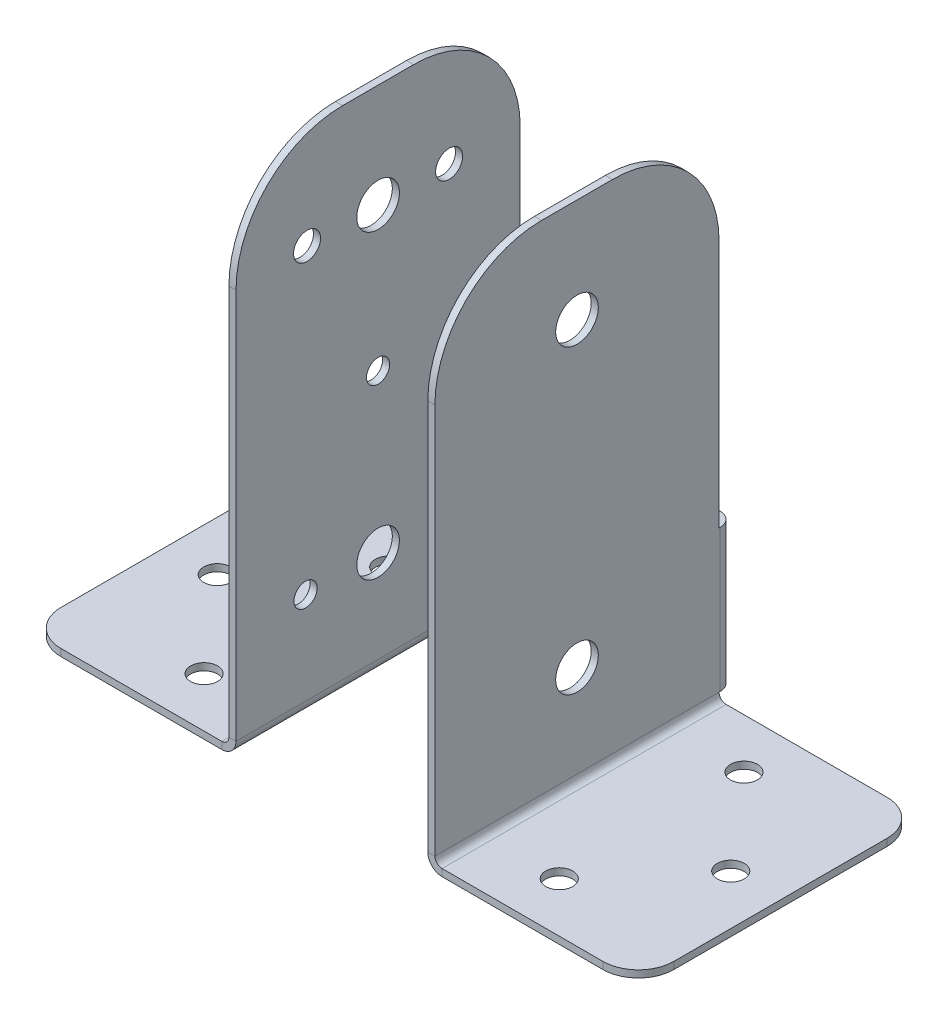
from build123d import *

# Parameters (mm, degrees)
BASE_FLANGE1_DEPTH         = 1
SKETCHED_START             = -40
SKETCHED_BEND3_OUTLINE_W   = 40
SKETCHED_BEND3_OUTLINE_H   = 1
SKETCHED_BEND3_DEPTH       = 28.18876
SKETCHED_START_2           = -11.2192
SKETCHED_BEND3_2_DEPTH     = 0.2192
SKETCHED_START_3           = -12
SKETCHED_BEND3_3_DEPTH     = 2
SKETCHED_START_4           = -56
SKETCHED_BEND3_4_DEPTH     = 112
SKETCHED_BEND7_DEPTH       = 72
SKETCHED_START_5           = -10
SKETCHED_BEND7_2_OUTLINE_W = 1
SKETCHED_BEND7_2_OUTLINE_H = 40
SKETCHED_BEND7_2_DEPTH     = 55
SKETCHED_BEND7_3_DEPTH     = 20
SKETCHED_BEND7_4_DEPTH     = 2
SKETCHED_START_6           = 45
SKETCHED_BEND7_5_OUTLINE_W = 1
SKETCHED_BEND7_5_OUTLINE_H = 40
SKETCHED_BEND7_5_DEPTH     = 15
SKETCHED_START_7           = 1.14380551
SKETCHED_BEND7_6_DEPTH     = 40
SKETCHED_START_8           = -38.14380551
SKETCHED_BEND7_7_DEPTH     = 76.28761102
SKETCH9_R                  = 3
CUT_EXTRUDE1_DEPTH         = 30
F_4_CLEARANCE_HOLE1_D      = 3.2639
F_4_CLEARANCE_HOLE1_DEPTH  = 3
F_4_CLEARANCE_HOLE1_TIP    = 0.980574487
F_6_CLEARANCE_HOLE1_D      = 3.7973
F_6_CLEARANCE_HOLE1_DEPTH  = 3
F_6_CLEARANCE_HOLE1_TIP    = 1.140824014
F_6_CLEARANCE_HOLE2_D      = 3.7973


with BuildPart() as part:
    # Base-Flange1: sheet metal written as solids
    # Sketch1 → Base-Flange1 (new body)
    with BuildSketch(Plane.XY):
        with BuildLine():
            Line((-15, -10), (-15, -35))
            ThreePointArc((-15, -35), (-16.464466094, -38.535533906), (-20, -40))
            Line((-20, -40), (-50, -40))
            ThreePointArc((-50, -40), (-53.535533906, -38.535533906), (-55, -35))
            Line((-55, -35), (-55, 45))
            ThreePointArc((-55, 45), (-50.606601718, 55.606601718), (-40, 60))
            Line((-40, 60), (-30, 60))
            ThreePointArc((-30, 60), (-19.393398282, 55.606601718), (-15, 45))
            Line((-15, 45), (-15, 10))
            Line((-15, 10), (15, 10))
            Line((15, 10), (15, 45))
            ThreePointArc((15, 45), (19.393398282, 55.606601718), (30, 60))
            Line((30, 60), (40, 60))
            ThreePointArc((40, 60), (50.606601718, 55.606601718), (55, 45))
            Line((55, 45), (55, -35))
            ThreePointArc((55, -35), (53.535533906, -38.535533906), (50, -40))
            Line((50, -40), (20, -40))
            ThreePointArc((20, -40), (16.464466094, -38.535533906), (15, -35))
            Line((15, -35), (15, -10))
            Line((15, -10), (-15, -10))
        make_face()
    extrude(amount=-BASE_FLANGE1_DEPTH)

    # Sketched Bend3: read off the stored shape, not the designer's step
    # Sketched Bend3 outline → Sketched Bend3 (cut)
    with BuildSketch(Plane(origin=(0, 0, 0), x_dir=(1, 0, 0), z_dir=(0, 1, 0)).offset(SKETCHED_START)):
        with Locations((-35, 0.5)):
            Rectangle(SKETCHED_BEND3_OUTLINE_W, SKETCHED_BEND3_OUTLINE_H)
        with Locations((35, 0.5)):
            Rectangle(SKETCHED_BEND3_OUTLINE_W, SKETCHED_BEND3_OUTLINE_H)
    extrude(amount=SKETCHED_BEND3_DEPTH, mode=Mode.SUBTRACT)

    # Sketched Bend3 2 outline → Sketched Bend3 2 (add)
    with BuildSketch(Plane(origin=(0, 0, 0), x_dir=(1, 0, 0), z_dir=(0, 1, 0)).offset(SKETCHED_START_2)):
        with BuildLine():
            Line((-15, 1), (-15, 24.64380551))
            ThreePointArc((-15, 24.64380551), (-16.464466094, 28.179339416), (-20, 29.64380551))
            Line((-20, 29.64380551), (-50, 29.64380551))
            ThreePointArc((-50, 29.64380551), (-53.535533906, 28.179339416), (-55, 24.64380551))
            Line((-55, 24.64380551), (-55, 1))
            Line((-55, 1), (-15, 1))
        make_face()
        with BuildLine():
            Line((15, 24.64380551), (15, 1))
            Line((15, 1), (55, 1))
            Line((55, 1), (55, 24.64380551))
            ThreePointArc((55, 24.64380551), (53.535533906, 28.179339416), (50, 29.64380551))
            Line((50, 29.64380551), (20, 29.64380551))
            ThreePointArc((20, 29.64380551), (16.464466094, 28.179339416), (15, 24.64380551))
        make_face()
    extrude(amount=SKETCHED_BEND3_2_DEPTH)

    # Sketched Bend3 3 outline → Sketched Bend3 3 (add)
    with BuildSketch(Plane(origin=(0, 0, 0), x_dir=(1, 0, 0), z_dir=(0, 1, 0)).offset(SKETCHED_START_3)):
        with BuildLine():
            Line((-15, 1), (-15, 24.64380551))
            ThreePointArc((-15, 24.64380551), (-16.464466094, 28.179339416), (-20, 29.64380551))
            Line((-20, 29.64380551), (-50, 29.64380551))
            ThreePointArc((-50, 29.64380551), (-53.535533906, 28.179339416), (-55, 24.64380551))
            Line((-55, 24.64380551), (-55, 1))
            Line((-55, 1), (-15, 1))
        make_face()
        with BuildLine():
            ThreePointArc((55, 24.64380551), (53.535533906, 28.179339416), (50, 29.64380551))
            Line((50, 29.64380551), (20, 29.64380551))
            ThreePointArc((20, 29.64380551), (16.464466094, 28.179339416), (15, 24.64380551))
            Line((15, 24.64380551), (15, 1))
            Line((15, 1), (55, 1))
            Line((55, 1), (55, 24.64380551))
        make_face()
    extrude(amount=SKETCHED_BEND3_3_DEPTH)

    # Sketched Bend3 4 outline → Sketched Bend3 4 (cut)
    with BuildSketch(Plane.YZ.offset(SKETCHED_START_4)):
        with BuildLine():
            Line((-11, -2), (-11, -29.64380551))
            Line((-11, -29.64380551), (-10, -29.64380551))
            Line((-10, -29.64380551), (-10, -1))
            ThreePointArc((-10, -1), (-10.707106781, -1.292893219), (-11, -2))
        make_face()
        with BuildLine():
            Line((-12, -1), (-12, -2))
            ThreePointArc((-12, -2), (-11.414213562, -0.585786438), (-10, 0))
            Line((-10, 0), (-11.81124, 0))
            Line((-11.81124, 0), (-11.81124, -1))
            Line((-11.81124, -1), (-12, -1))
        make_face()
    extrude(amount=SKETCHED_BEND3_4_DEPTH, mode=Mode.SUBTRACT)

    # Sketched Bend7: read off the stored shape, not the designer's step
    # Sketched Bend7 outline → Sketched Bend7 (cut)
    with BuildSketch(Plane(origin=(0, 0, 0), x_dir=(1, 0, 0), z_dir=(0, 1, 0)).offset(SKETCHED_START_3)):
        with BuildLine():
            ThreePointArc((-14.232050807, 0), (-13.5, 0.732050807), (-12.5, 1))
            Line((-12.5, 1), (-15, 1))
            Line((-15, 1), (-15, 24.64380551))
            ThreePointArc((-15, 24.64380551), (-16.464466094, 28.179339416), (-20, 29.64380551))
            Line((-20, 29.64380551), (-50, 29.64380551))
            ThreePointArc((-50, 29.64380551), (-53.535533906, 28.179339416), (-55, 24.64380551))
            Line((-55, 24.64380551), (-55, 0))
            Line((-55, 0), (-14.232050807, 0))
        make_face()
        with BuildLine():
            Line((15, 1), (12.5, 1))
            ThreePointArc((12.5, 1), (13.5, 0.732050807), (14.232050807, 0))
            Line((14.232050807, 0), (55, 0))
            Line((55, 0), (55, 24.64380551))
            ThreePointArc((55, 24.64380551), (53.535533906, 28.179339416), (50, 29.64380551))
            Line((50, 29.64380551), (20, 29.64380551))
            ThreePointArc((20, 29.64380551), (16.464466094, 28.179339416), (15, 24.64380551))
            Line((15, 24.64380551), (15, 1))
        make_face()
    extrude(amount=SKETCHED_BEND7_DEPTH, mode=Mode.SUBTRACT)



with BuildPart() as body_2:
    # Sketched Bend7 2 outline → Sketched Bend7 2 (new body)
    with BuildSketch(Plane(origin=(0, 0, 0), x_dir=(1, 0, 0), z_dir=(0, 1, 0)).offset(SKETCHED_START_5)):
        with Locations((-14, -21.14380551)):
            Rectangle(SKETCHED_BEND7_2_OUTLINE_W, SKETCHED_BEND7_2_OUTLINE_H)
        with Locations((14, -21.14380551)):
            Rectangle(SKETCHED_BEND7_2_OUTLINE_W, SKETCHED_BEND7_2_OUTLINE_H)
    extrude(amount=SKETCHED_BEND7_2_DEPTH)


with BuildPart() as part_1:
    add(part.part)

    add(body_2.part)  # Sketched Bend7 3 merges body 2
    # Sketched Bend7 3 outline → Sketched Bend7 3 (add)
    with BuildSketch(Plane(origin=(0, 0, 0), x_dir=(1, 0, 0), z_dir=(0, 1, 0)).offset(SKETCHED_START_5)):
        with BuildLine():
            Line((-12.5, 0), (-14.232050807, 0))
            ThreePointArc((-14.232050807, 0), (-14.431851652, -0.48236191), (-14.5, -1))
            Line((-14.5, -1), (-14.5, -1.14380551))
            Line((-14.5, -1.14380551), (-13.5, -1.14380551))
            Line((-13.5, -1.14380551), (-13.5, -1))
            ThreePointArc((-13.5, -1), (-13.207106781, -0.292893219), (-12.5, 0))
        make_face()
        with BuildLine():
            ThreePointArc((14.5, -1), (14.431851652, -0.48236191), (14.232050807, 0))
            Line((14.232050807, 0), (12.5, 0))
            ThreePointArc((12.5, 0), (13.207106781, -0.292893219), (13.5, -1))
            Line((13.5, -1), (13.5, -1.14380551))
            Line((13.5, -1.14380551), (14.5, -1.14380551))
            Line((14.5, -1.14380551), (14.5, -1))
        make_face()
    extrude(amount=SKETCHED_BEND7_3_DEPTH)

    # Sketched Bend7 4 outline → Sketched Bend7 4 (add)
    with BuildSketch(Plane(origin=(0, 0, 0), x_dir=(1, 0, 0), z_dir=(0, 1, 0)).offset(SKETCHED_START_3)):
        with BuildLine():
            ThreePointArc((-43.14380551, -36.14380551), (-41.679339416, -39.679339416), (-38.14380551, -41.14380551))
            Line((-38.14380551, -41.14380551), (-13.5, -41.14380551))
            Line((-13.5, -41.14380551), (-13.5, -1.14380551))
            Line((-13.5, -1.14380551), (-38.14380551, -1.14380551))
            ThreePointArc((-38.14380551, -1.14380551), (-41.679339416, -2.608271604), (-43.14380551, -6.14380551))
            Line((-43.14380551, -6.14380551), (-43.14380551, -36.14380551))
        make_face()
        with BuildLine():
            ThreePointArc((38.14380551, -41.14380551), (41.679339416, -39.679339416), (43.14380551, -36.14380551))
            Line((43.14380551, -36.14380551), (43.14380551, -6.14380551))
            ThreePointArc((43.14380551, -6.14380551), (41.679339416, -2.608271604), (38.14380551, -1.14380551))
            Line((38.14380551, -1.14380551), (13.5, -1.14380551))
            Line((13.5, -1.14380551), (13.5, -41.14380551))
            Line((13.5, -41.14380551), (38.14380551, -41.14380551))
        make_face()
    extrude(amount=SKETCHED_BEND7_4_DEPTH)

    # Sketched Bend7 5 outline → Sketched Bend7 5 (add)
    with BuildSketch(Plane(origin=(0, 0, 0), x_dir=(1, 0, 0), z_dir=(0, 1, 0)).offset(SKETCHED_START_6)):
        with Locations((-14, -21.14380551)):
            Rectangle(SKETCHED_BEND7_5_OUTLINE_W, SKETCHED_BEND7_5_OUTLINE_H)
        with Locations((14, -21.14380551)):
            Rectangle(SKETCHED_BEND7_5_OUTLINE_W, SKETCHED_BEND7_5_OUTLINE_H)
    extrude(amount=SKETCHED_BEND7_5_DEPTH)

    # Sketched Bend7 6 outline → Sketched Bend7 6 (cut)
    with BuildSketch(Plane.XY.offset(SKETCHED_START_7)):
        with BuildLine():
            Line((-43.14380551, -11), (-15.5, -11))
            ThreePointArc((-15.5, -11), (-14.792893219, -10.707106781), (-14.5, -10))
            Line((-14.5, -10), (-43.14380551, -10))
            Line((-43.14380551, -10), (-43.14380551, -11))
        make_face()
        with BuildLine():
            ThreePointArc((-13.5, -10), (-14.085786438, -11.414213562), (-15.5, -12))
            Line((-15.5, -12), (-13.5, -12))
            Line((-13.5, -12), (-13.5, -10))
        make_face()
        with BuildLine():
            Line((15.5, -11), (43.14380551, -11))
            Line((43.14380551, -11), (43.14380551, -10))
            Line((43.14380551, -10), (14.5, -10))
            ThreePointArc((14.5, -10), (14.792893219, -10.707106781), (15.5, -11))
        make_face()
        with BuildLine():
            Line((13.5, -12), (15.5, -12))
            ThreePointArc((15.5, -12), (14.085786438, -11.414213562), (13.5, -10))
            Line((13.5, -10), (13.5, -12))
        make_face()
    extrude(amount=SKETCHED_BEND7_6_DEPTH, mode=Mode.SUBTRACT)

    # Sketched Bend7 7 outline → Sketched Bend7 7 (cut)
    with BuildSketch(Plane.YZ.offset(SKETCHED_START_8)):
        with BuildLine():
            ThreePointArc((45, 41.14380551), (55.606601718, 36.750407228), (60, 26.14380551))
            Line((60, 26.14380551), (60, 41.14380551))
            Line((60, 41.14380551), (45, 41.14380551))
        make_face()
        with BuildLine():
            ThreePointArc((60, 16.14380551), (55.606601718, 5.537203792), (45, 1.14380551))
            Line((45, 1.14380551), (60, 1.14380551))
            Line((60, 1.14380551), (60, 16.14380551))
        make_face()
    extrude(amount=SKETCHED_BEND7_7_DEPTH, mode=Mode.SUBTRACT)

    # Sketch9 → Cut-Extrude1 (cut)
    with BuildSketch(Plane.ZY.offset(14.5)):
        with Locations(Location((21.14380551, 3, 0), (0, 0, 180))):
            Circle(SKETCH9_R)
        with Locations(Location((21.14380551, 45.4, 0), (0, 0, 180))):
            Circle(SKETCH9_R)
    extrude(amount=-CUT_EXTRUDE1_DEPTH, mode=Mode.SUBTRACT)

    # #4 Clearance Hole1
    with Locations(Plane.ZY.offset(14.5)):
        with Locations((10.93300551, 3), (31.35460551, 3), (21.14380551, 25.1742)):
            Hole(F_4_CLEARANCE_HOLE1_D / 2, depth=F_4_CLEARANCE_HOLE1_DEPTH)
            with Locations((0, 0, -(F_4_CLEARANCE_HOLE1_DEPTH + F_4_CLEARANCE_HOLE1_TIP / 2))):  # 118° drill point
                Cone(0, F_4_CLEARANCE_HOLE1_D / 2, F_4_CLEARANCE_HOLE1_TIP, mode=Mode.SUBTRACT)

    # #6 Clearance Hole1
    with Locations(Plane.ZY.offset(14.5)):
        with Locations((11.14380551, 45.4), (31.14380551, 45.4)):
            Hole(F_6_CLEARANCE_HOLE1_D / 2, depth=F_6_CLEARANCE_HOLE1_DEPTH)
            with Locations((0, 0, -(F_6_CLEARANCE_HOLE1_DEPTH + F_6_CLEARANCE_HOLE1_TIP / 2))):  # 118° drill point
                Cone(0, F_6_CLEARANCE_HOLE1_D / 2, F_6_CLEARANCE_HOLE1_TIP, mode=Mode.SUBTRACT)

    # #6 Clearance Hole2 (through all)
    with Locations(Plane(origin=(0, -11, 0), x_dir=(1, 0, 0), z_dir=(0, 1, 0))):
        with Locations((-36.14380551, -21.14380551), (-25, -34.14380551), (25, -34.14380551), (36.14380551, -21.14380551), (-25, -8.14380551), (25, -8.14380551)):
            Hole(F_6_CLEARANCE_HOLE2_D / 2)


solid = part_1.part
